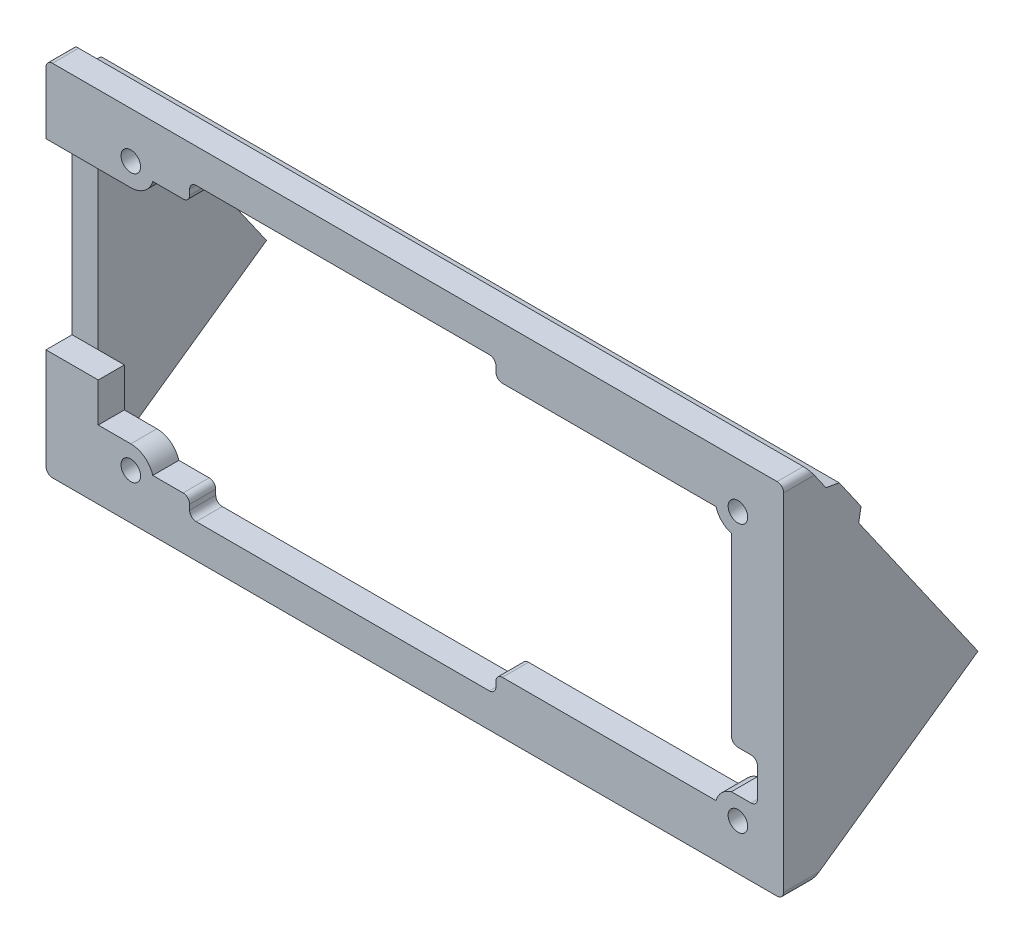
from build123d import *

# Parameters (mm, degrees)
SKETCH_1_W          = 112.98899933
SKETCH_1_H          = 54.999998897
SKETCH_1_W_2        = 96.98899933
SKETCH_1_H_2        = 38.999998897
EXTRUDE_1_DEPTH     = 4
EXTRUDE_1_2_DEPTH   = 4
SKETCH_2_R          = 1.5
SKETCH_2_W          = 8
SKETCH_2_H          = 28
CUT_EXTRUDE_1_DEPTH = 10
EXTRUDE_2_DEPTH     = 4
EXTRUDE_3_DEPTH     = 112.988999
CHAMFER_1_SIZE      = 2
CUT_EXTRUDE_2_DEPTH = 4
SKETCH_7_W          = 4
SKETCH_7_H          = 6.380551841
SKETCH_7_W_2        = 46.91800116
SKETCH_7_H_2        = 38.999998897
SKETCH_7_H_3        = 2.8
CUT_EXTRUDE_3_DEPTH = 4
FILLET_2_R          = 1
FILLET_4_R          = 1


with BuildPart() as part:
    # 스케치1 → Extrude 1 (new body)
    with BuildSketch(Plane(origin=(0, 0, 96.68635878), x_dir=(-1, 0, 0), z_dir=(0, 0, -1))):
        with Locations((20.108635155, 0.89540154)):
            Rectangle(SKETCH_1_W, SKETCH_1_H)
        with Locations((20.108635155, 0.89540154)):
            Rectangle(SKETCH_1_W_2, SKETCH_1_H_2, mode=Mode.SUBTRACT)
    extrude(amount=EXTRUDE_1_DEPTH)

    # 스케치3 → Extrude 1 2 (add)
    with BuildSketch(Plane(origin=(0, 0, 92.68635878), x_dir=(-1, 0, 0), z_dir=(0, 0, -1))):
        with BuildLine():
            Line((-28.38586451, 20.395400989), (-26.02132888, 20.395400989))
            ThreePointArc((-26.02132888, 20.395400989), (-25.912420969, 20.89013871), (-25.87586451, 21.395400989))
            ThreePointArc((-25.87586451, 21.395400989), (-32.199234375, 23.494222087), (-28.38586451, 18.03086536))
            Line((-28.38586451, 18.03086536), (-28.38586451, 20.395400989))
        make_face()
        with BuildLine():
            ThreePointArc((-28.38586451, 18.03086536), (-26.903919708, 18.913456187), (-26.02132888, 20.395400989))
            Line((-26.02132888, 20.395400989), (-28.38586451, 20.395400989))
            Line((-28.38586451, 20.395400989), (-28.38586451, 18.03086536))
        make_face()
        with BuildLine():
            Line((-28.38586451, -18.604597908), (-28.38586451, -16.24006219))
            ThreePointArc((-28.38586451, -16.24006219), (-32.199234375, -21.703418917), (-25.87586451, -19.604597819))
            ThreePointArc((-25.87586451, -19.604597819), (-25.912420962, -19.099335586), (-26.021328854, -18.604597908))
            Line((-26.021328854, -18.604597908), (-28.38586451, -18.604597908))
        make_face()
        with BuildLine():
            ThreePointArc((-26.021328854, -18.604597908), (-26.903919675, -17.12265305), (-28.38586451, -16.24006219))
            Line((-28.38586451, -16.24006219), (-28.38586451, -18.604597908))
            Line((-28.38586451, -18.604597908), (-26.021328854, -18.604597908))
        make_face()
        with BuildLine():
            ThreePointArc((66.978670192, -18.604597908), (65.712955672, -16.791227981), (63.614134537, -16.094597819))
            Line((63.614134537, -16.094597819), (63.614134537, -18.604597908))
            Line((63.614134537, -18.604597908), (66.978670192, -18.604597908))
        make_face()
        with BuildLine():
            Line((63.614134537, -18.604597908), (63.614134537, -16.094597819))
            ThreePointArc((63.614134537, -16.094597819), (61.515313402, -16.791227981), (60.249598881, -18.604597908))
            Line((60.249598881, -18.604597908), (63.614134537, -18.604597908))
        make_face()
        with BuildLine():
            Line((66.978670192, -18.604597908), (63.614134537, -18.604597908))
            Line((63.614134537, -18.604597908), (63.614134537, -23.114597819))
            ThreePointArc((63.614134537, -23.114597819), (66.096079339, -22.086542621), (67.124134537, -19.604597819))
            ThreePointArc((67.124134537, -19.604597819), (67.087578084, -19.099335586), (66.978670192, -18.604597908))
        make_face()
        with BuildLine():
            Line((63.614134537, -23.114597819), (63.614134537, -18.604597908))
            Line((63.614134537, -18.604597908), (60.249598881, -18.604597908))
            ThreePointArc((60.249598881, -18.604597908), (60.800764699, -21.703418954), (63.614134537, -23.114597819))
        make_face()
        with BuildLine():
            Line((68.60313482, -18.604597908), (68.60313482, -16.094597819))
            Line((68.60313482, -16.094597819), (63.614134537, -16.094597819))
            ThreePointArc((63.614134537, -16.094597819), (65.712955672, -16.791227981), (66.978670192, -18.604597908))
            Line((66.978670192, -18.604597908), (68.60313482, -18.604597908))
        make_face()
        with BuildLine():
            ThreePointArc((60.249598907, 20.395400989), (61.515313439, 18.582031123), (63.614134537, 17.885400989))
            Line((63.614134537, 17.885400989), (63.614134537, 20.395400989))
            Line((63.614134537, 20.395400989), (60.249598907, 20.395400989))
        make_face()
        with BuildLine():
            Line((63.614134537, 20.395400989), (63.614134537, 17.885400989))
            ThreePointArc((63.614134537, 17.885400989), (65.712955634, 18.582031123), (66.978670166, 20.395400989))
            Line((66.978670166, 20.395400989), (63.614134537, 20.395400989))
        make_face()
        with BuildLine():
            Line((60.249598907, 20.395400989), (63.614134537, 20.395400989))
            Line((63.614134537, 20.395400989), (63.614134537, 24.905400989))
            ThreePointArc((63.614134537, 24.905400989), (60.800764671, 23.494222087), (60.249598907, 20.395400989))
        make_face()
        with BuildLine():
            Line((63.614134537, 24.905400989), (63.614134537, 20.395400989))
            Line((63.614134537, 20.395400989), (66.978670166, 20.395400989))
            ThreePointArc((66.978670166, 20.395400989), (67.087578077, 20.89013871), (67.124134537, 21.395400989))
            ThreePointArc((67.124134537, 21.395400989), (66.096079339, 23.877345791), (63.614134537, 24.905400989))
        make_face()
        with BuildLine():
            ThreePointArc((66.978670166, 20.395400989), (65.712955634, 18.582031123), (63.614134537, 17.885400989))
            Line((63.614134537, 17.885400989), (68.60313482, 17.885400989))
            Line((68.60313482, 17.885400989), (68.60313482, 20.395400989))
            Line((68.60313482, 20.395400989), (66.978670166, 20.395400989))
        make_face()
    extrude(amount=-EXTRUDE_1_2_DEPTH)

    # 스케치2 → 컷-돌출1 (cut)
    with BuildSketch(Plane.XY.offset(96.68635878)):
        with Locations((-63.614134537, -19.604597819)):
            Circle(SKETCH_2_R)
        with Locations((29.38586451, -19.604597819)):
            Circle(SKETCH_2_R)
        with Locations((29.38586451, 21.395400989)):
            Circle(SKETCH_2_R)
        with Locations((-63.614134537, 21.395400989)):
            Circle(SKETCH_2_R)
        with Locations((-72.60313482, 3.882984922)):
            Rectangle(SKETCH_2_W, SKETCH_2_H)
    extrude(amount=-CUT_EXTRUDE_1_DEPTH, mode=Mode.SUBTRACT)

    # 스케치4 → 보스-돌출2 (add)
    with BuildSketch(Plane.ZY.offset(76.60313482)):
        Polygon((92.68635878, -26.604597908), (92.68635878, 28.395400989), (66.913727288, -8.493235012), align=None)
    extrude_2 = extrude(amount=-EXTRUDE_2_DEPTH)

    # 대칭 복사1: 보스-돌출2 across plane
    add(extrude_2.mirror(Plane.ZY.offset(20.108635155)))

    # 스케치5 → 보스-돌출3 (add)
    with BuildSketch(Plane.ZY.offset(76.60313482)):
        Polygon((84.830484946, 19.691692545), (85.189902425, 17.665644896), (90.206974689, 24.846632704), (88.18092704, 24.487215225), align=None)
        Polygon((85.189902425, 17.665644896), (85.075357396, 17.501695402), (82.377306183, 13.639946589), (84.016801117, 12.4944963), (95.126134542, 28.395400989), (92.68635878, 28.395400989), (90.321519717, 25.010582197), (90.206974689, 24.846632704), align=None)
    extrude(amount=-EXTRUDE_3_DEPTH)

    # 모따기1
    chamfer_1_edges = [part.edges().sort_by_distance(p)[0] for p in [
        (-20.108635155, 12.4944963, 84.016801117),
    ]]
    chamfer(chamfer_1_edges, length=CHAMFER_1_SIZE - 0.0001)  # a hair under: the kernel refuses the full size

    # 스케치6 → 컷-돌출2 (cut)
    with BuildSketch(Plane(origin=(0, -33.367910571, 47.759838088), x_dir=(-1, 0, 0), z_dir=(0, 0.5727251442659632, -0.8197474666783251))):
        with BuildLine():
            ThreePointArc((52.208634465, 67.723569041), (50.106933191, 69.821866387), (48.008635845, 67.720165113))
            Line((48.008635845, 67.720165113), (50.108635155, 67.721867077))
            Line((50.108635155, 67.721867077), (52.208634465, 67.723569041))
        make_face()
        with BuildLine():
            Line((50.108635155, 67.721867077), (48.008635845, 67.720165113))
            ThreePointArc((48.008635845, 67.720165113), (50.109486137, 65.62186725), (52.208635155, 67.721867077))
            ThreePointArc((52.208635155, 67.721867077), (52.208634983, 67.722718059), (52.208634465, 67.723569041))
            Line((52.208634465, 67.723569041), (50.108635155, 67.721867077))
        make_face()
        with BuildLine():
            ThreePointArc((-7.791365535, 67.674941484), (-9.893066809, 69.77323883), (-11.991364155, 67.671537556))
            Line((-11.991364155, 67.671537556), (-9.891364845, 67.67323952))
            Line((-9.891364845, 67.67323952), (-7.791365535, 67.674941484))
        make_face()
        with BuildLine():
            Line((-9.891364845, 67.67323952), (-11.991364155, 67.671537556))
            ThreePointArc((-11.991364155, 67.671537556), (-9.890513863, 65.573239692), (-7.791364845, 67.67323952))
            ThreePointArc((-7.791364845, 67.67323952), (-7.791365017, 67.674090502), (-7.791365535, 67.674941484))
            Line((-7.791365535, 67.674941484), (-9.891364845, 67.67323952))
        make_face()
    extrude(amount=-CUT_EXTRUDE_2_DEPTH, mode=Mode.SUBTRACT)

    # 스케치7 → 컷-돌출3 (cut)
    with BuildSketch(Plane(origin=(0, 0, 92.68635878), x_dir=(-1, 0, 0), z_dir=(0, 0, -1))):
        with Locations((-30.38586451, -13.04978627)):
            Rectangle(SKETCH_7_W, SKETCH_7_H)
        with Locations((31.145135519, 0.89540154)):
            Rectangle(SKETCH_7_W_2, SKETCH_7_H_2)
        with Locations((31.145135519, 21.795400989)):
            Rectangle(SKETCH_7_W_2, SKETCH_7_H_3)
        with Locations((31.145135519, -20.004597908)):
            Rectangle(SKETCH_7_W_2, SKETCH_7_H_3)
    extrude(amount=-CUT_EXTRUDE_3_DEPTH, mode=Mode.SUBTRACT)

    # 필렛2
    fillet_2_edges = [part.edges().sort_by_distance(p)[0] for p in [
        (-7.686134939, 20.395400989, 94.68635878),
        (-54.604136099, 20.395400989, 94.68635878),
        (28.38586451, -9.859510349, 94.68635878),
        (32.38586451, -16.24006219, 94.68635878),
        (32.38586451, -9.859510349, 94.68635878),
        (-54.604136099, -18.604597908, 94.68635878),
        (-7.686134939, -18.604597908, 94.68635878),
        (-7.686134939, -21.404597908, 94.68635878),
        (-54.604136099, 23.195400989, 94.68635878),
        (-54.604136099, -21.404597908, 94.68635878),
        (-7.686134939, 23.195400989, 94.68635878),
    ]]
    fillet(fillet_2_edges, radius=FILLET_2_R)

    # 필렛4
    fillet_4_edges = [part.edges().sort_by_distance(p)[0] for p in [
        (36.38586451, 28.395400989, 94.68635878),
        (-76.60313482, 28.395400989, 94.68635878),
        (-76.60313482, -26.604597908, 94.68635878),
        (36.38586451, -26.604597908, 94.68635878),
    ]]
    fillet(fillet_4_edges, radius=FILLET_4_R)


solid = part.part
